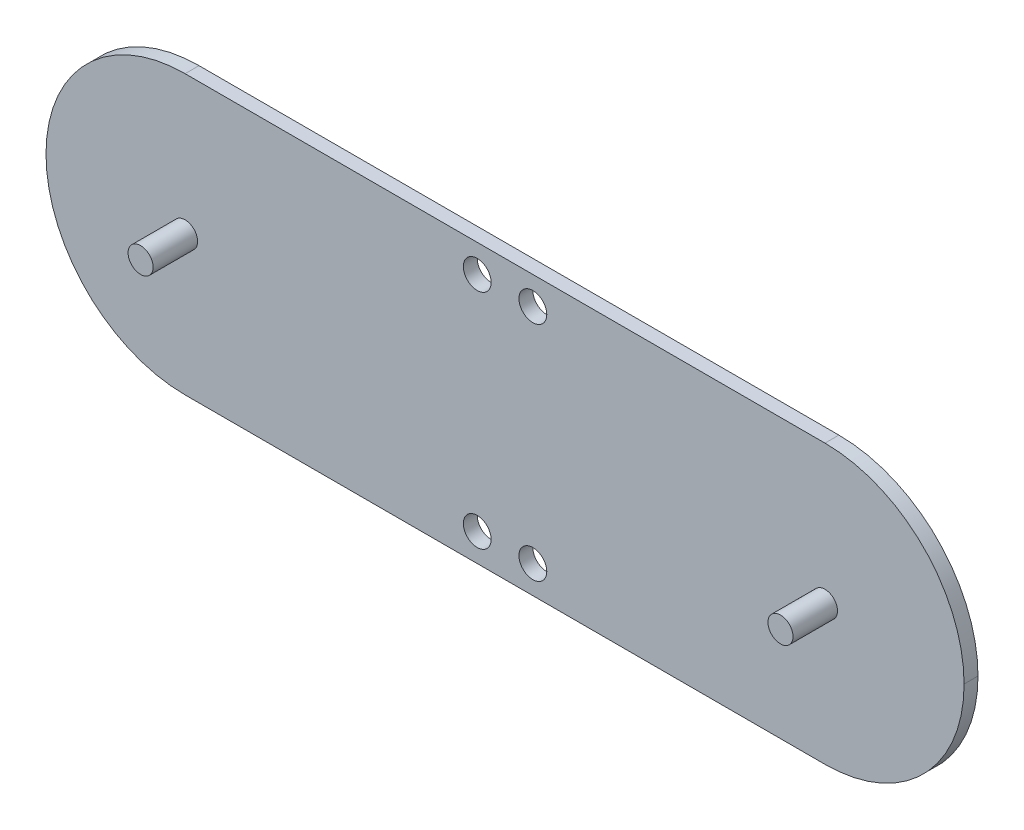
from build123d import *

# Parameters (mm, degrees)
SKETCH1_W           = 165
SKETCH1_H           = 50
BOSS_EXTRUDE1_DEPTH = 2.5
FILLET1_R           = 25
SKETCH2_R           = 2.5
CUT_EXTRUDE1_DEPTH  = 2.5
SKETCH4_R           = 2.25
BOSS_EXTRUDE2_DEPTH = 8


with BuildPart() as part:
    # Sketch1 → Boss-Extrude1 (new body)
    with BuildSketch(Plane.XY):
        Rectangle(SKETCH1_W, SKETCH1_H)
    extrude(amount=BOSS_EXTRUDE1_DEPTH)

    # Fillet1
    fillet1_edges = [part.edges().sort_by_distance(p)[0] for p in [
        (-82.5, -25, 1.25),
        (-82.5, 25, 1.25),
        (82.5, -25, 1.25),
        (82.5, 25, 1.25),
    ]]
    fillet(fillet1_edges, radius=FILLET1_R - 0.0001)  # a hair under: the kernel refuses the full size

    # Sketch2 → Cut-Extrude1 (cut)
    with BuildSketch(Plane.XY.offset(2.5)):
        with Locations((-5, 20)):
            Circle(SKETCH2_R)
        with Locations((5, 20)):
            Circle(SKETCH2_R)
    cut_extrude1 = extrude(amount=-CUT_EXTRUDE1_DEPTH, mode=Mode.SUBTRACT)

    # Mirror1: Cut-Extrude1 across plane
    add(cut_extrude1.mirror(Plane.ZX), mode=Mode.SUBTRACT)

    # Sketch4 → Boss-Extrude2 (add)
    with BuildSketch(Plane.XY.offset(2.5)):
        with Locations(Location((-57.5, 0, 0), (0, 0, 180))):
            Circle(SKETCH4_R)
    boss_extrude2 = extrude(amount=BOSS_EXTRUDE2_DEPTH)

    # Mirror3: Boss-Extrude2 across plane
    add(boss_extrude2.mirror(Plane(origin=(0, 0, 0), x_dir=(0, 0, 1), z_dir=(1, 0, 0))))


solid = part.part
